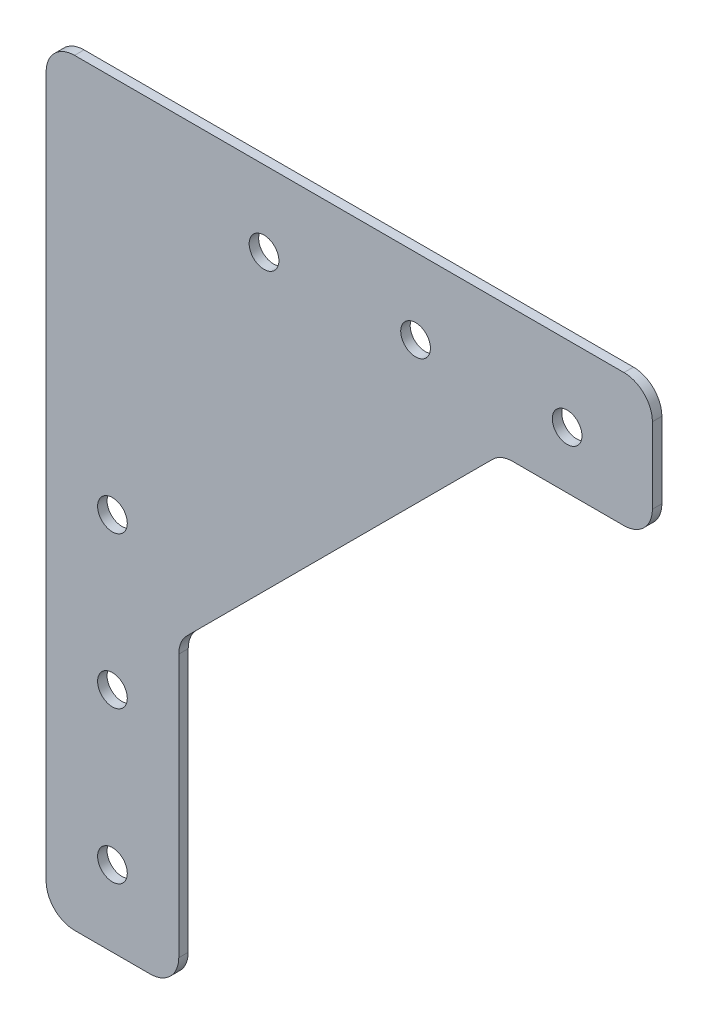
from build123d import *

# Parameters (mm, degrees)
SKETCH1_R           = 2.4892
BOSS_EXTRUDE1_DEPTH = 0.79375
FILLET1_R           = 4.7625


with BuildPart() as part:
    # Sketch1 → Boss-Extrude1 (new, symmetric)
    with BuildSketch(Plane.XY):
        Polygon((0, 127), (0, 0), (22.225, 0), (22.225, 50.8), (76.2, 104.775), (101.6, 104.775), (101.6, 127), align=None)
        with Locations((11.1125, 63.5)):
            Circle(SKETCH1_R, mode=Mode.SUBTRACT)
        with Locations((11.1125, 38.1)):
            Circle(SKETCH1_R, mode=Mode.SUBTRACT)
        with Locations((11.1125, 12.7)):
            Circle(SKETCH1_R, mode=Mode.SUBTRACT)
        with Locations((36.5125, 114.3)):
            Circle(SKETCH1_R, mode=Mode.SUBTRACT)
        with Locations((61.9125, 114.3)):
            Circle(SKETCH1_R, mode=Mode.SUBTRACT)
        with Locations((87.3125, 114.3)):
            Circle(SKETCH1_R, mode=Mode.SUBTRACT)
    extrude(amount=BOSS_EXTRUDE1_DEPTH, both=True)

    # Fillet1
    fillet1_edges = [part.edges().sort_by_distance(p)[0] for p in [
        (0, 127, 0),
        (0, 0, 0),
        (101.6, 104.775, 0),
        (76.2, 104.775, 0),
        (22.225, 50.8, 0),
        (22.225, 0, 0),
        (101.6, 127, 0),
    ]]
    fillet(fillet1_edges, radius=FILLET1_R)


solid = part.part
